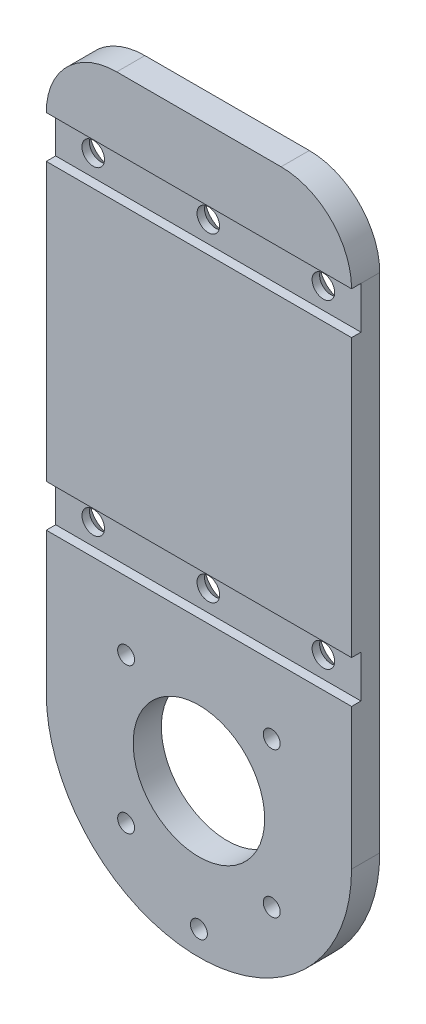
from build123d import *

# Parameters (mm, degrees)
BOSS_EXTRUDE1_DEPTH                             = 6
M3_CLEARANCE_HOLE1_D                            = 3.6
M3_CLEARANCE_HOLE1_DEPTH                        = 6
M3_CLEARANCE_HOLE1_TIP                          = 1.081549114
FILLET1_R                                       = 15
SKETCH4_W                                       = 65
SKETCH4_H                                       = 9
SKETCH4_W_2                                     = 32.5
CUT_EXTRUDE1_DEPTH                              = 2
M4_CLEARANCE_HOLE1_D                            = 4.8
M4_CLEARANCE_HOLE1_DEPTH                        = 6
M4_CLEARANCE_HOLE1_TIP                          = 1.442065486
CHAMFER1_SIZE                                   = 2.4
SKETCH7_W                                       = 65
SKETCH7_H                                       = 78
CUT_EXTRUDE3_DEPTH                              = 132.713704678
FILLET2_R                                       = 15
CSK_FOR_M3_FLAT_HEAD_MACHINE_SCREW1_D           = 3.6
CSK_FOR_M3_FLAT_HEAD_MACHINE_SCREW1_DEPTH       = 20
CSK_FOR_M3_FLAT_HEAD_MACHINE_SCREW1_CSINK_D     = 6.3
CSK_FOR_M3_FLAT_HEAD_MACHINE_SCREW1_CSINK_ANGLE = 90
CSK_FOR_M3_FLAT_HEAD_MACHINE_SCREW1_TIP         = 1.081549114


with BuildPart() as part:
    # Sketch1 → Boss-Extrude1 (new body)
    with BuildSketch(Plane.XY):
        with BuildLine():
            Line((-32.5, 95), (-32.5, -95))
            ThreePointArc((-32.5, -95), (0, -62.5), (32.5, -95))
            Line((32.5, -95), (32.5, 95))
            Line((32.5, 95), (-32.5, 95))
        make_face()
        with BuildLine():
            ThreePointArc((32.5, -95), (0, -62.5), (-32.5, -95))
            Line((-32.5, -95), (-15.5, -95))
            Line((-15.5, -95), (-15.5, -79.5))
            Line((-15.5, -79.5), (15.5, -79.5))
            Line((15.5, -79.5), (15.5, -95))
            Line((15.5, -95), (32.5, -95))
        make_face()
        with BuildLine():
            Line((-15.5, -95), (-32.5, -95))
            ThreePointArc((-32.5, -95), (0, -127.5), (32.5, -95))
            Line((32.5, -95), (15.5, -95))
            Line((15.5, -95), (15.5, -110.5))
            Line((15.5, -110.5), (-15.5, -110.5))
            Line((-15.5, -110.5), (-15.5, -95))
        make_face()
        with BuildLine():
            Line((-14, -95), (-15.5, -95))
            Line((-15.5, -95), (-15.5, -110.5))
            Line((-15.5, -110.5), (15.5, -110.5))
            Line((15.5, -110.5), (15.5, -95))
            Line((15.5, -95), (14, -95))
            ThreePointArc((14, -95), (0, -109), (-14, -95))
        make_face()
        with BuildLine():
            Line((-15.5, -79.5), (-15.5, -95))
            Line((-15.5, -95), (-14, -95))
            ThreePointArc((-14, -95), (0, -81), (14, -95))
            Line((14, -95), (15.5, -95))
            Line((15.5, -95), (15.5, -79.5))
            Line((15.5, -79.5), (-15.5, -79.5))
        make_face()
    extrude(amount=BOSS_EXTRUDE1_DEPTH)

    # M3 Clearance Hole1
    with Locations(Plane(origin=(0, 0, 0), x_dir=(-1, 0, 0), z_dir=(0, 0, -1))):
        with Locations((-15.5, -110.5), (15.5, -110.5), (15.5, -79.5), (-15.5, -79.5)):
            Hole(M3_CLEARANCE_HOLE1_D / 2, depth=M3_CLEARANCE_HOLE1_DEPTH)
            with Locations((0, 0, -(M3_CLEARANCE_HOLE1_DEPTH + M3_CLEARANCE_HOLE1_TIP / 2))):  # 118° drill point
                Cone(0, M3_CLEARANCE_HOLE1_D / 2, M3_CLEARANCE_HOLE1_TIP, mode=Mode.SUBTRACT)

    # Fillet1
    fillet1_edges = [part.edges().sort_by_distance(p)[0] for p in [
        (-32.5, 95, 3),
        (32.5, 95, 3),
    ]]
    fillet(fillet1_edges, radius=FILLET1_R)

    # Sketch4 → Cut-Extrude1 (cut)
    with BuildSketch(Plane.XY.offset(6)):
        with Locations((0, 75.5)):
            Rectangle(SKETCH4_W, SKETCH4_H)
        with Locations((-16.25, 7.5)):
            Rectangle(SKETCH4_W_2, SKETCH4_H)
        with Locations((16.25, 7.5)):
            Rectangle(SKETCH4_W_2, SKETCH4_H)
        with Locations((0, -60.5)):
            Rectangle(SKETCH4_W, SKETCH4_H)
    extrude(amount=-CUT_EXTRUDE1_DEPTH, mode=Mode.SUBTRACT)

    # M4 Clearance Hole1
    with Locations(Plane.XY.offset(4)):
        with Locations((-24.5, -60.5), (-24.5, 75.5), (24.5, 75.5), (0, 75.5), (-24.5, 7.5), (0, 7.5), (24.5, 7.5), (24.5, -60.5), (0, -60.5)):
            Hole(M4_CLEARANCE_HOLE1_D / 2, depth=M4_CLEARANCE_HOLE1_DEPTH)
            with Locations((0, 0, -(M4_CLEARANCE_HOLE1_DEPTH + M4_CLEARANCE_HOLE1_TIP / 2))):  # 118° drill point
                Cone(0, M4_CLEARANCE_HOLE1_D / 2, M4_CLEARANCE_HOLE1_TIP, mode=Mode.SUBTRACT)

    # Chamfer1
    chamfer1_edges = [part.edges().sort_by_distance(p)[0] for p in [
        (-22.1, -60.5, 0),
        (2.4, -60.5, 0),
        (26.9, -60.5, 0),
        (26.9, 7.5, 0),
        (2.4, 7.5, 0),
        (-22.1, 7.5, 0),
        (2.4, 75.5, 0),
        (26.9, 75.5, 0),
        (-22.1, 75.5, 0),
        (13.7, -79.5, 0),
        (-17.3, -79.5, 0),
        (-17.3, -110.5, 0),
        (13.7, -110.5, 0),
    ]]
    chamfer(chamfer1_edges, length=CHAMFER1_SIZE)

    # Sketch7 → Cut-Extrude3 (cut, through all)
    with BuildSketch(Plane.XY.offset(6)):
        with Locations((0, 66)):
            Rectangle(SKETCH7_W, SKETCH7_H)
    extrude(amount=-CUT_EXTRUDE3_DEPTH, mode=Mode.SUBTRACT)

    # Fillet2
    fillet2_edges = [part.edges().sort_by_distance(p)[0] for p in [
        (32.5, 27, 3),
        (-32.5, 27, 3),
    ]]
    fillet(fillet2_edges, radius=FILLET2_R - 0.0001)  # a hair under: the kernel refuses the full size

    # CSK for M3 Flat Head Machine Screw1
    with Locations(Plane(origin=(0, 0, 0), x_dir=(1, 0, 0), z_dir=(0, 0, -1))):
        with Locations((0, 122.3)):
            CounterSinkHole(CSK_FOR_M3_FLAT_HEAD_MACHINE_SCREW1_D / 2, CSK_FOR_M3_FLAT_HEAD_MACHINE_SCREW1_CSINK_D / 2, depth=CSK_FOR_M3_FLAT_HEAD_MACHINE_SCREW1_DEPTH, counter_sink_angle=CSK_FOR_M3_FLAT_HEAD_MACHINE_SCREW1_CSINK_ANGLE)
            with Locations((0, 0, -(CSK_FOR_M3_FLAT_HEAD_MACHINE_SCREW1_DEPTH + CSK_FOR_M3_FLAT_HEAD_MACHINE_SCREW1_TIP / 2))):  # 118° drill point
                Cone(0, CSK_FOR_M3_FLAT_HEAD_MACHINE_SCREW1_D / 2, CSK_FOR_M3_FLAT_HEAD_MACHINE_SCREW1_TIP, mode=Mode.SUBTRACT)


solid = part.part
